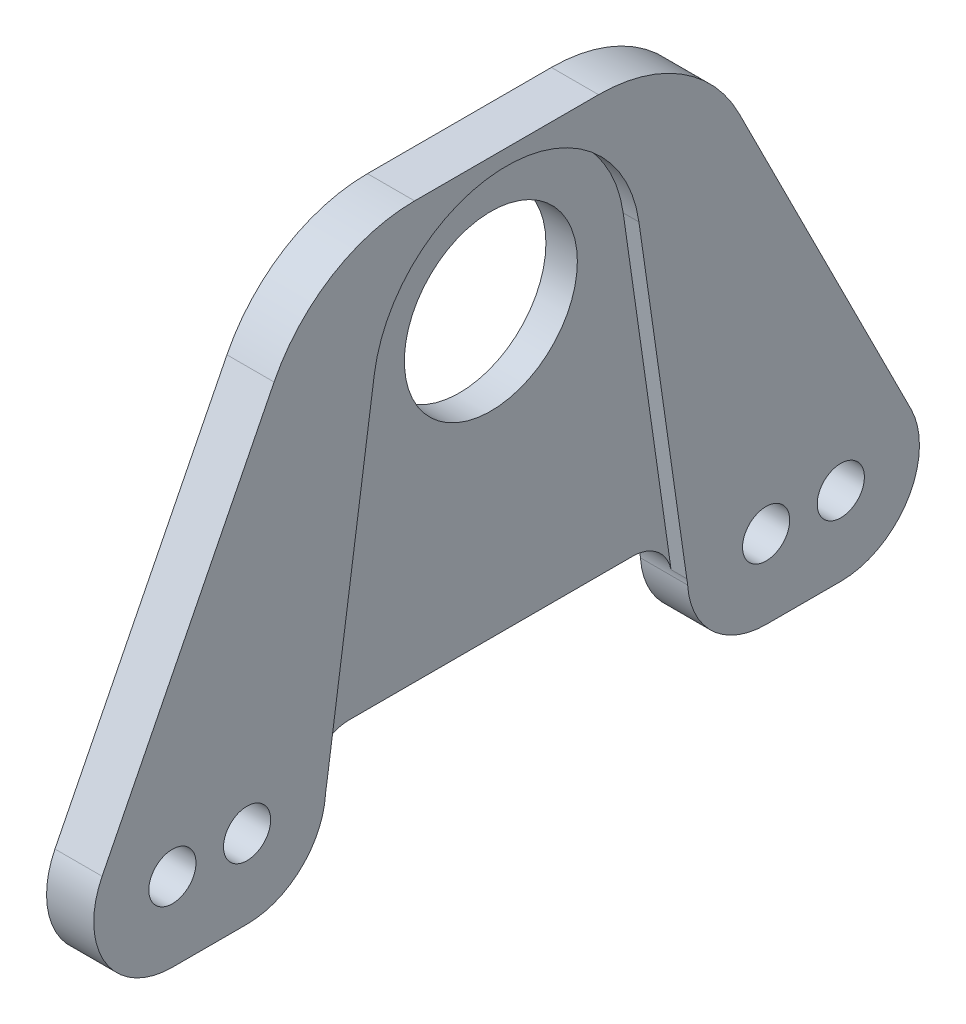
from build123d import *

# Parameters (mm, degrees)
SZKIC2_R                    = 3
SZKIC2_R_2                  = 11
DODANIE_WYCI_GNI_CIE1_DEPTH = 6
WYTNIJ_WYCI_GNI_CIE1_DEPTH  = 2


with BuildPart() as part:
    # Szkic2 → Dodanie-wyciągnięcie1 (new body)
    with BuildSketch(Plane(origin=(0, 0, 0), x_dir=(0, 0, -1), z_dir=(1, 0, 0))):
        with BuildLine():
            Line((-42.498348754, -50), (-33, -50))
            ThreePointArc((-33, -50), (-26.168699489, -47.302967433), (-23.022246969, -40.666666667))
            ThreePointArc((-23.022246969, -40.666666667), (-21.449020708, -37.348516283), (-18.033370453, -36))
            Line((-18.033370453, -36), (18.033370453, -36))
            ThreePointArc((18.033370453, -36), (21.449020708, -37.348516283), (23.022246969, -40.666666667))
            ThreePointArc((23.022246969, -40.666666667), (26.168699489, -47.302967433), (33, -50))
            Line((33, -50), (42.498348754, -50))
            ThreePointArc((42.498348754, -50), (51.010776649, -45.247720584), (51.432517371, -35.507714266))
            Line((51.432517371, -35.507714266), (29.563691841, 7.984571468))
            ThreePointArc((29.563691841, 7.984571468), (22.190795774, 16.02485579), (11.695354606, 19))
            Line((11.695354606, 19), (-11.695354606, 19))
            ThreePointArc((-11.695354606, 19), (-22.190795774, 16.02485579), (-29.563691841, 7.984571468))
            Line((-29.563691841, 7.984571468), (-51.432517371, -35.507714266))
            ThreePointArc((-51.432517371, -35.507714266), (-51.010776649, -45.247720584), (-42.498348754, -50))
        make_face()
        with Locations((-42.498348754, -40)):
            Circle(SZKIC2_R, mode=Mode.SUBTRACT)
        with Locations((-33, -40)):
            Circle(SZKIC2_R, mode=Mode.SUBTRACT)
        with Locations((42.498348754, -40)):
            Circle(SZKIC2_R, mode=Mode.SUBTRACT)
        with Locations((33, -40)):
            Circle(SZKIC2_R, mode=Mode.SUBTRACT)
        Circle(SZKIC2_R_2, mode=Mode.SUBTRACT)
    extrude(amount=DODANIE_WYCI_GNI_CIE1_DEPTH)

    # Szkic3 → Wytnij-wyciągnięcie1 (cut)
    with BuildSketch(Plane(origin=(6, 0, 0), x_dir=(0, 0, -1), z_dir=(1, 0, 0))):
        with BuildLine():
            Line((-23.022246969, -40.666666667), (-16.826939856, 2.419523732))
            ThreePointArc((-16.826939856, 2.419523732), (0, 17), (16.826939856, 2.419523732))
            Line((16.826939856, 2.419523732), (23.022246969, -40.666666667))
            Line((23.022246969, -40.666666667), (-23.022246969, -40.666666667))
        make_face()
    extrude(amount=-WYTNIJ_WYCI_GNI_CIE1_DEPTH, mode=Mode.SUBTRACT)


solid = part.part
